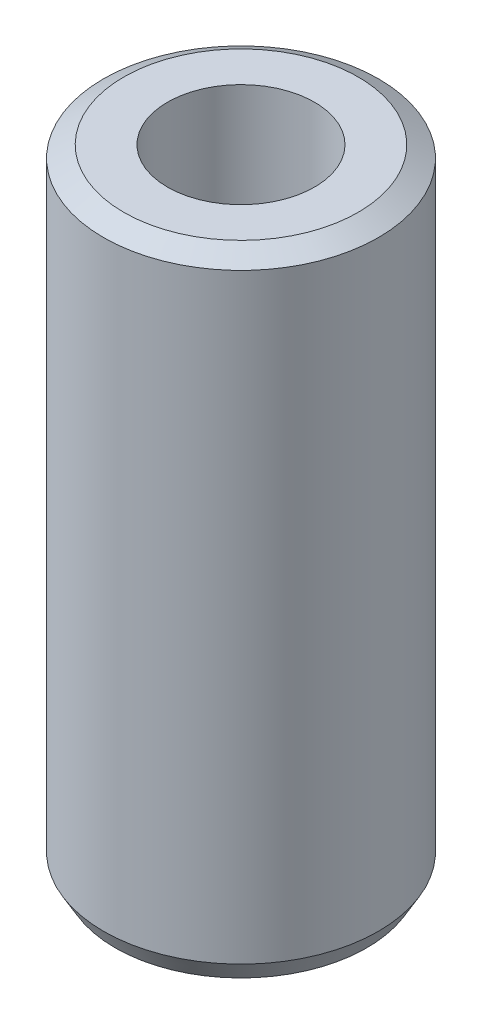
from build123d import *
from OCP.BRepFilletAPI import BRepFilletAPI_MakeChamfer

# Parameters (mm, degrees)
SKETCH1_R           = 27.5
BOSS_EXTRUDE1_DEPTH = 126.547188051
SKETCH2_R           = 14.714660043
CUT_EXTRUDE1_DEPTH  = 133.388408872
CHAMFER1_SIZE       = 2.338678077
CHAMFER1_SIZE2      = 4.050709252


with BuildPart() as part:
    # Sketch1 → Boss-Extrude1 (new body)
    with BuildSketch(Plane(origin=(0, 0, 0), x_dir=(1, 0, 0), z_dir=(0, 1, 0))):
        Circle(SKETCH1_R)
    extrude(amount=BOSS_EXTRUDE1_DEPTH)

    # Sketch2 → Cut-Extrude1 (cut, through all)
    with BuildSketch(Plane(origin=(0, 0, 0), x_dir=(1, 0, 0), z_dir=(0, 1, 0))):
        Circle(SKETCH2_R)
    extrude(amount=CUT_EXTRUDE1_DEPTH, mode=Mode.SUBTRACT)

    # Chamfer1: one chamfer whose edges measure the first distance from different faces: ONE call of the kernel's chamfer builder (chamfer() names one face for all edges)
    chamfer1_edges_1 = [part.edges().sort_by_distance(p)[0] for p in [
        (-27.5, 126.547188051, 0),
    ]]
    chamfer1_side_1 = [part.faces().sort_by_distance(p)[0] for p in [
        (-27.5, 63.273594026, 0),
    ]]
    chamfer1_edges_2 = [part.edges().sort_by_distance(p)[0] for p in [
        (-27.5, 0, 0),
    ]]
    chamfer1_side_2 = [part.faces().sort_by_distance(p)[0] for p in [
        (-26.722182541, 0, 0),
    ]]
    chamfer1 = BRepFilletAPI_MakeChamfer(part.part.solid().wrapped)
    for e in chamfer1_edges_1:
        chamfer1.Add(CHAMFER1_SIZE, CHAMFER1_SIZE2, e.wrapped, chamfer1_side_1[0].wrapped)  # the first distance lies on this face
    for e in chamfer1_edges_2:
        chamfer1.Add(CHAMFER1_SIZE, CHAMFER1_SIZE2, e.wrapped, chamfer1_side_2[0].wrapped)  # the first distance lies on this face
    add(Compound.cast(chamfer1.Shape()), mode=Mode.REPLACE)


solid = part.part
